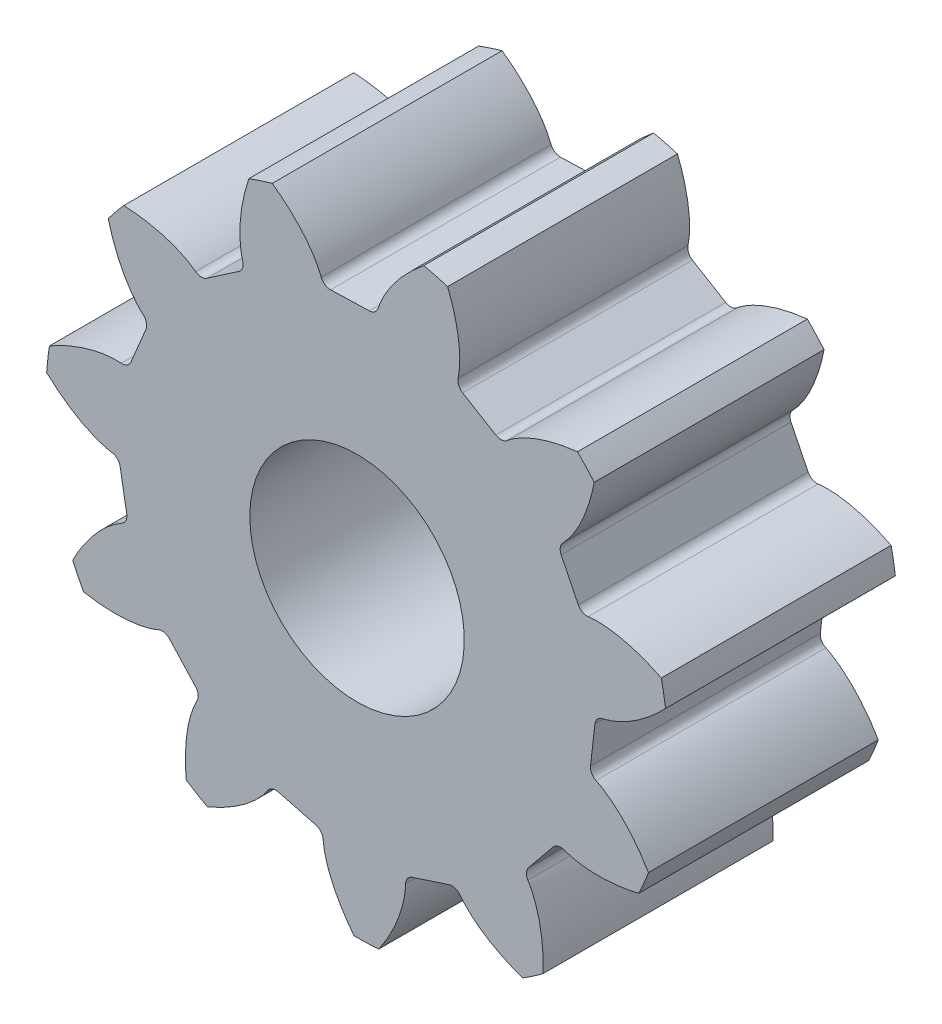
from build123d import *

# Parameters (mm, degrees)
SKETCH2_R                = 8.125
BOSS_EXTRUDE1_DEPTH      = 6
CUT_EXTRUDE1_DEPTH       = 6
FILLET1_R                = 0.254
CIRPATTERN3_COUNT        = 11
FILLET1_OF_CIRPATTERN3_R = 0.254
SKETCH3_R                = 2.8
CUT_EXTRUDE2_DEPTH       = 13.949053966


# Read off the part's stored shape, not the designer's step: Cut-Extrude1
with BuildPart() as part:
    # Sketch2 → Boss-Extrude1 (new body)
    with BuildSketch(Plane.XY):
        Circle(SKETCH2_R)
    extrude(amount=BOSS_EXTRUDE1_DEPTH)

    # Cut-Extrude1 outline → Cut-Extrude1 (cut)
    with BuildSketch(Plane.XY):
        with BuildLine():
            add(Edge.make_bspline(
                [(6.230866036, 0), (6.235473566, 0), (6.248392879, 0.000301816), (6.272788752, 0.002063982), (6.312468264, 0.006627701), (6.362772665, 0.014915466), (6.427377148, 0.028451165), (6.502836081, 0.04800427), (6.584940383, 0.073240914), (6.673231189, 0.104698853), (6.760286137, 0.139587561), (6.846067267, 0.177612608), (6.93049542, 0.218374425), (7.031447847, 0.271104951), (7.150597351, 0.338972511), (7.28681308, 0.424902383), (7.437483479, 0.530044423), (7.586576545, 0.645159253), (7.729488298, 0.764898307), (7.865628813, 0.88978132), (7.961316066, 0.983260547), (8.023830686, 1.04791121), (8.053063977, 1.078788946)],
                knots=[0, 0, 0, 0, 0, 0.005376748, 0.015083688, 0.02853182, 0.046610139, 0.064854849, 0.092110525, 0.119476175, 0.146842495, 0.174208853, 0.201574955, 0.228941013, 0.256307345, 0.307035032, 0.361767351, 0.41649966, 0.471231936, 0.525964281, 0.580696615, 0.629881812, 0.629881812, 0.629881812, 0.629881812, 0.629881812], degree=4))
            Line((6.230866036, 0), (6.072908509, -1.39408529))
            add(Edge.make_bspline(
                [(7.607545512, -2.853222087), (7.585961851, -2.816586512), (7.539496877, -2.739587861), (7.467150286, -2.627069476), (7.362402195, -2.47489246), (7.249903621, -2.326214012), (7.130345817, -2.180659561), (7.007019369, -2.044472173), (6.89348265, -1.930243975), (6.792538275, -1.837438569), (6.70594293, -1.76345785), (6.632775091, -1.70483954), (6.557676253, -1.648585909), (6.48063417, -1.595104105), (6.401619963, -1.544689589), (6.327243484, -1.501722811), (6.258072281, -1.465782317), (6.198134032, -1.438135242), (6.150959182, -1.418802542), (6.113306658, -1.405476679), (6.089923505, -1.398300886), (6.077399235, -1.395116172), (6.072908509, -1.39408529)],
                knots=[0.279209104, 0.279209104, 0.279209104, 0.279209104, 0.279209104, 0.328394301, 0.383126635, 0.43785898, 0.492591256, 0.547323565, 0.602055884, 0.652783571, 0.680149903, 0.707515961, 0.734882063, 0.762248421, 0.789614741, 0.816980391, 0.844236067, 0.862480777, 0.880559096, 0.894007228, 0.903714168, 0.909090916, 0.909090916, 0.909090916, 0.909090916, 0.909090916], degree=4))
            ThreePointArc((7.607545512, -2.853222087), (8.07334194, -0.914754021), (8.053063977, 1.078788946))
        make_face()
    cut_extrude1 = extrude(amount=CUT_EXTRUDE1_DEPTH, mode=Mode.SUBTRACT)

    # Fillet1
    fillet1_edges = [part.edges().sort_by_distance(p)[0] for p in [
        (6.072908509, -1.39408529, 3),
        (6.230866036, 0, 3),
    ]]
    fillet(fillet1_edges, radius=FILLET1_R)

    # CirPattern3: Cut-Extrude1 ×11 about axis
    cirpattern3_axis = Axis((0, 0, 18.908609159), (0, 0, -1))
    for i in range(1, CIRPATTERN3_COUNT):
        add(cut_extrude1.rotate(cirpattern3_axis, i * 360 / CIRPATTERN3_COUNT), mode=Mode.SUBTRACT)

    # Fillet1 of CirPattern3
    fillet1_of_cirpattern3_edges = [part.edges().sort_by_distance(p)[0] for p in [
        (4.355156327, -4.456041396, 3),
        (5.241738065, -3.368660507, 3),
        (1.254672783, -6.103235844, 3),
        (2.588395295, -5.667795105, 3),
        (-2.244160504, -5.812696034, 3),
        (-0.886744692, -6.167444804, 3),
        (-5.030488688, -3.676666305, 3),
        (-4.080349505, -4.708974355, 3),
        (-6.219672257, -0.373321001, 3),
        (-5.978472181, -1.75543782, 3),
        (-5.434153831, 3.048551082, 3),
        (-5.978472181, 1.75543782, 3),
        (-2.923329959, 5.502529737, 3),
        (-4.080349505, 4.708974355, 3),
        (0.51563052, 6.209494079, 3),
        (-0.886744692, 6.167444804, 3),
        (3.790881951, 4.944987926, 3),
        (2.588395295, 5.667795105, 3),
        (5.862555149, 2.110483045, 3),
        (5.241738065, 3.368660507, 3),
    ]]
    fillet(fillet1_of_cirpattern3_edges, radius=FILLET1_OF_CIRPATTERN3_R)

    # Sketch3 → Cut-Extrude2 (cut, through all)
    with BuildSketch(Plane(origin=(0, 0, 0), x_dir=(-1, 0, 0), z_dir=(0, 0, -1))):
        Circle(SKETCH3_R)
    extrude(amount=-CUT_EXTRUDE2_DEPTH, mode=Mode.SUBTRACT)


solid = part.part
